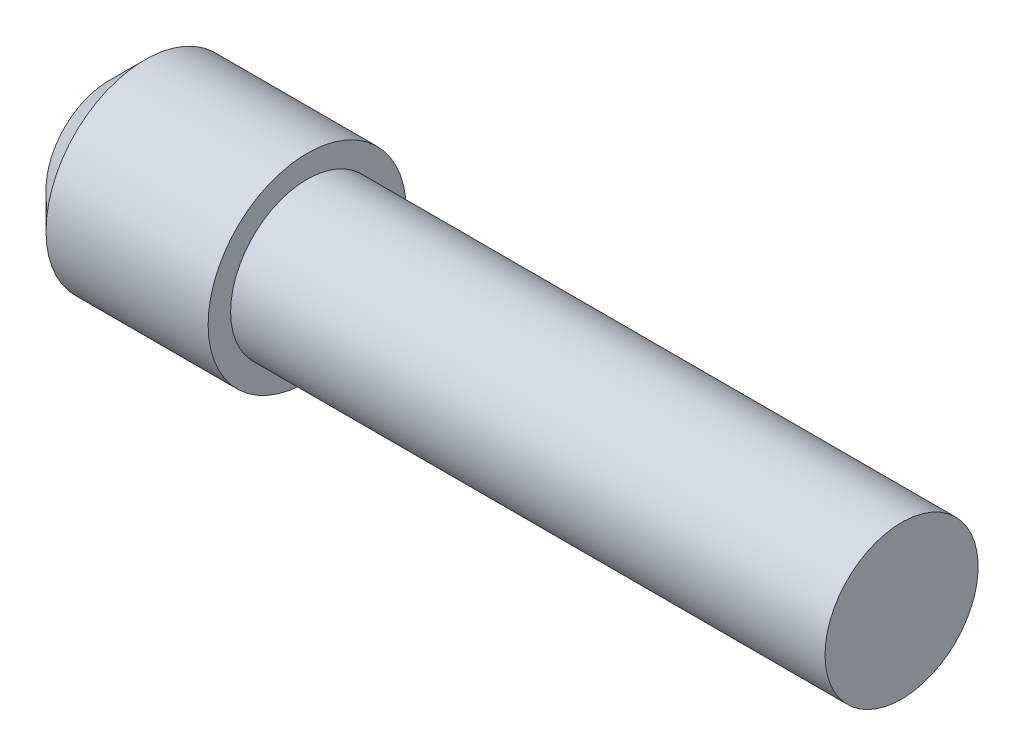
from build123d import *

# Parameters (mm, degrees)
CHAMFER1_SIZE = 1


with BuildPart() as part:
    # Sketch1 → Revolve1 (revolve)
    with BuildSketch(Plane.XY):
        Polygon((0, 2.75), (-5.5, 2.75), (-5.5, 0), (16.5, 0), (16.5, 2.125), (0, 2.125), align=None)
    revolve(axis=Axis((-9.458937198, 0, 0), (1, 0, 0)))

    # Chamfer1
    chamfer1_edges = [part.edges().sort_by_distance(p)[0] for p in [
        (-5.5, -2.75, 0),
    ]]
    chamfer(chamfer1_edges, length=CHAMFER1_SIZE)


solid = part.part
